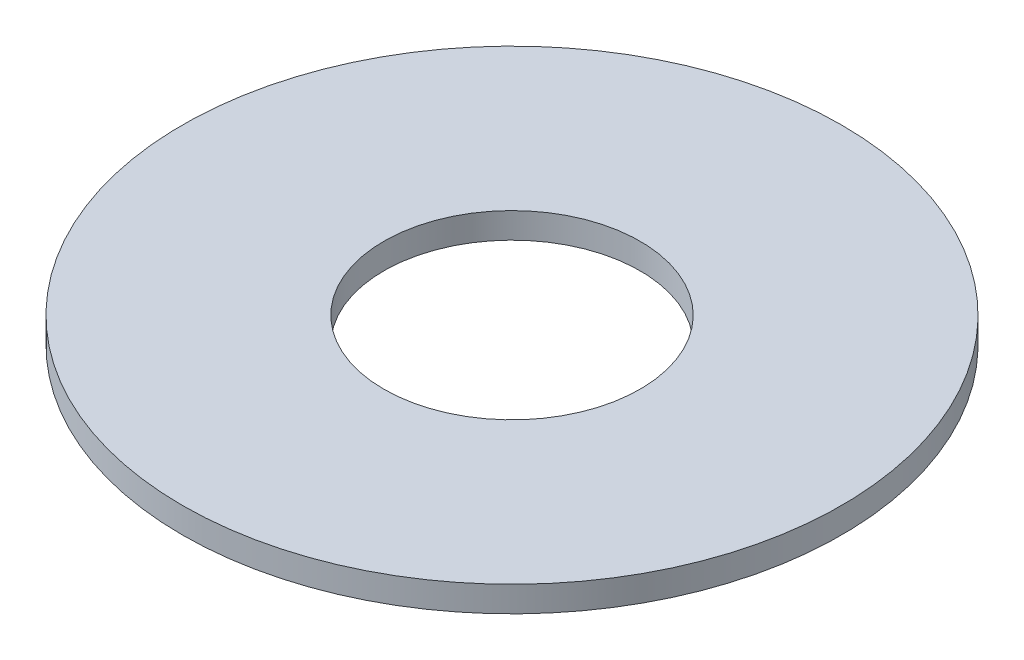
from build123d import *

# Parameters (mm, degrees)
SKETCH1_R           = 90
BOSS_EXTRUDE1_DEPTH = 7
SKETCH2_R           = 35
CUT_EXTRUDE1_DEPTH  = 128.471565457


with BuildPart() as part:
    # Sketch1 → Boss-Extrude1 (new body)
    with BuildSketch(Plane(origin=(0, 0, 0), x_dir=(1, 0, 0), z_dir=(0, 1, 0))):
        Circle(SKETCH1_R)
    extrude(amount=BOSS_EXTRUDE1_DEPTH)

    # Sketch2 → Cut-Extrude1 (cut, through all)
    with BuildSketch(Plane(origin=(0, 0, 0), x_dir=(1, 0, 0), z_dir=(0, 1, 0))):
        Circle(SKETCH2_R)
    extrude(amount=CUT_EXTRUDE1_DEPTH, mode=Mode.SUBTRACT)


solid = part.part
